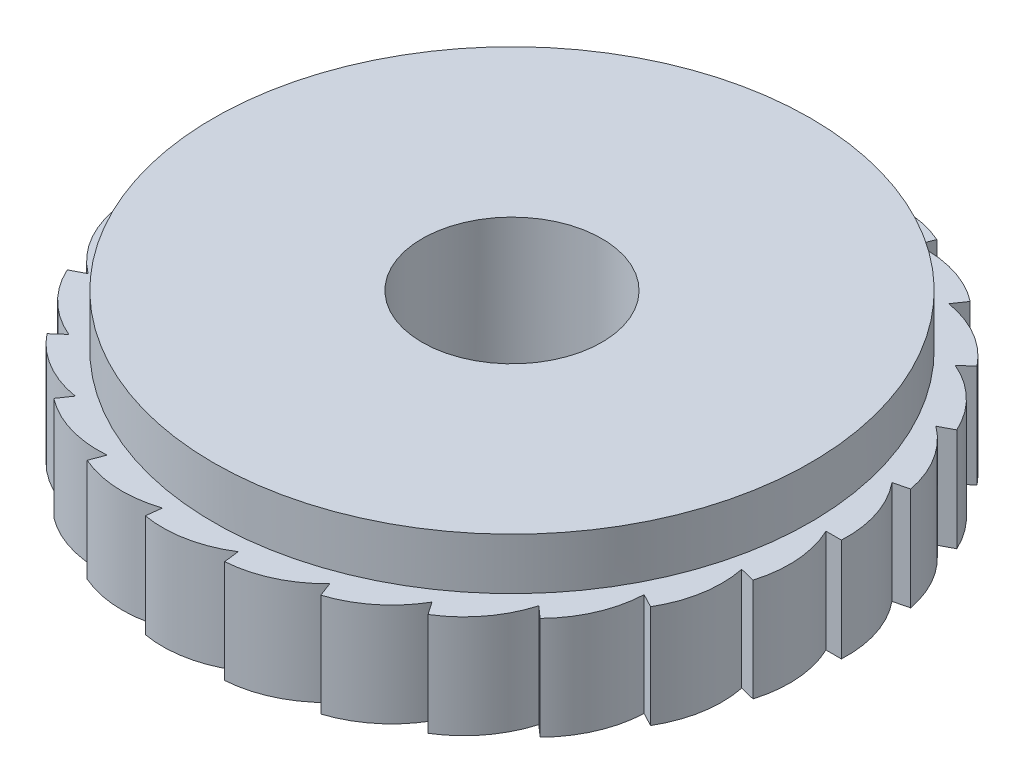
from build123d import *

# Parameters (mm, degrees)
EXTRUDE_RATCHET_EDGE_DEPTH      = 10
PATTERN_EDGE_TO_FORM_GEAR_COUNT = 26
ITERATION_WHEEL_R               = 29
EXTRUDE_ITERATION_WHEEL_DEPTH   = 5
SKETCH7_R                       = 8.73125
CUT_EXTRUDE2_DEPTH              = 48.636347813


with BuildPart() as part:
    # Sketch1 → Extrude ratchet edge (new body)
    with BuildSketch(Plane(origin=(0, 0, 0), x_dir=(1, 0, 0), z_dir=(0, 1, 0))):
        with BuildLine():
            Line((0, 0), (29.613725431, 7.299127761))
            ThreePointArc((29.613725431, 7.299127761), (31.486736206, 3.871832194), (32, 0))
            Line((32, 0), (0, 0))
        make_face()
    extrude_ratchet_edge = extrude(amount=EXTRUDE_RATCHET_EDGE_DEPTH)

    # Pattern edge to form gear: Extrude ratchet edge ×26 about axis
    pattern_edge_to_form_gear_axis = Axis((0, 10, 0), (0, -1, 0))
    for i in range(1, PATTERN_EDGE_TO_FORM_GEAR_COUNT):
        add(extrude_ratchet_edge.rotate(pattern_edge_to_form_gear_axis, i * 360 / PATTERN_EDGE_TO_FORM_GEAR_COUNT))

    # Iteration wheel → Extrude iteration wheel (add)
    with BuildSketch(Plane(origin=(0, 10, 0), x_dir=(1, 0, 0), z_dir=(0, 1, 0))):
        Circle(ITERATION_WHEEL_R)
    extrude(amount=EXTRUDE_ITERATION_WHEEL_DEPTH)

    # Sketch7 → Cut-Extrude2 (cut, through all)
    with BuildSketch(Plane(origin=(0, 15, 0), x_dir=(1, 0, 0), z_dir=(0, 1, 0))):
        Circle(SKETCH7_R)
    extrude(amount=-CUT_EXTRUDE2_DEPTH, mode=Mode.SUBTRACT)


solid = part.part
